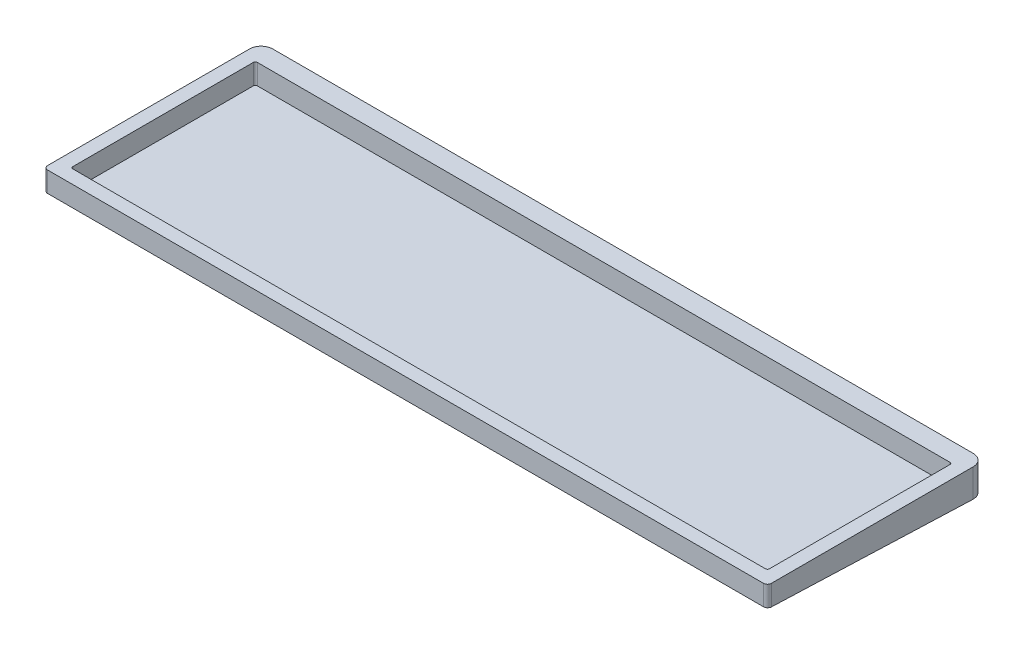
from build123d import *

# Parameters (mm, degrees)
BOSS_EXTRUDE1_DEPTH = 10.5
BOSS_EXTRUDE3_START = 10.5
BOSS_EXTRUDE3_DEPTH = 10.5
CUT_EXTRUDE1_DEPTH  = 400
CUT_EXTRUDE2_DEPTH  = 40
CUT_EXTRUDE3_DEPTH  = 40


with BuildPart() as part:
    # Sketch2 → Boss-Extrude1 (new body)
    with BuildSketch(Plane(origin=(0, 0, 0), x_dir=(1, 0, 0), z_dir=(0, 1, 0))):
        with BuildLine():
            Line((180.825, 57.625), (-180.825, 57.625))
            ThreePointArc((-180.825, 57.625), (-185.067640687, 55.867640687), (-186.825, 51.625))
            Line((-186.825, 51.625), (-186.825, -52.625))
            ThreePointArc((-186.825, -52.625), (-186.239213562, -54.039213562), (-184.825, -54.625))
            Line((-184.825, -54.625), (184.825, -54.625))
            ThreePointArc((184.825, -54.625), (186.239213562, -54.039213562), (186.825, -52.625))
            Line((186.825, -52.625), (186.825, 51.625))
            ThreePointArc((186.825, 51.625), (185.067640687, 55.867640687), (180.825, 57.625))
        make_face()
        with BuildLine():
            Line((-179.825, -46.625), (-179.825, 46.625))
            ThreePointArc((-179.825, 46.625), (-179.532106781, 47.332106781), (-178.825, 47.625))
            Line((-178.825, 47.625), (178.825, 47.625))
            ThreePointArc((178.825, 47.625), (179.532106781, 47.332106781), (179.825, 46.625))
            Line((179.825, 46.625), (179.825, -46.625))
            ThreePointArc((179.825, -46.625), (179.532106781, -47.332106781), (178.825, -47.625))
            Line((178.825, -47.625), (-178.825, -47.625))
            ThreePointArc((-178.825, -47.625), (-179.532106781, -47.332106781), (-179.825, -46.625))
        make_face(mode=Mode.SUBTRACT)
    extrude(amount=BOSS_EXTRUDE1_DEPTH)

    # Sketch4 → Boss-Extrude3 (add)
    with BuildSketch(Plane.XZ.offset(BOSS_EXTRUDE3_START)):
        with BuildLine():
            ThreePointArc((180.825, -57.625), (185.067640687, -55.867640687), (186.825, -51.625))
            Line((186.825, -51.625), (186.825, 52.625))
            ThreePointArc((186.825, 52.625), (186.239213562, 54.039213562), (184.825, 54.625))
            Line((184.825, 54.625), (-184.825, 54.625))
            ThreePointArc((-184.825, 54.625), (-186.239213562, 54.039213562), (-186.825, 52.625))
            Line((-186.825, 52.625), (-186.825, -51.625))
            ThreePointArc((-186.825, -51.625), (-185.067640687, -55.867640687), (-180.825, -57.625))
            Line((-180.825, -57.625), (180.825, -57.625))
        make_face()
    extrude(amount=-BOSS_EXTRUDE3_DEPTH)

    # Sketch5 → Cut-Extrude1 (cut)
    with BuildSketch(Plane(origin=(186.825, 0, 0), x_dir=(0, 0, -1), z_dir=(1, 0, 0))):
        Polygon((57.625, -10.5), (57.625, -4), (51.625, -4), (40.947921748, -10.5), align=None)
        Polygon((40.947921748, -10.5), (-54.625, 0), (-54.625, -10.5), align=None)
    extrude(amount=-CUT_EXTRUDE1_DEPTH, mode=Mode.SUBTRACT)

    # Sketch6 → Cut-Extrude2 (cut)
    with BuildSketch(Plane(origin=(186.825, 0, 0), x_dir=(0, 0, -1), z_dir=(1, 0, 0))):
        Polygon((-54.625, 0), (51.625, -4), (40.947921748, -10.5), align=None)
    extrude(amount=-CUT_EXTRUDE2_DEPTH, mode=Mode.SUBTRACT)

    # Sketch7 → Cut-Extrude3 (cut)
    with BuildSketch(Plane.ZY.offset(186.825)):
        Polygon((-51.625, -4), (-40.947921748, -10.5), (52.625, -0.219727509), align=None)
    extrude(amount=-CUT_EXTRUDE3_DEPTH, mode=Mode.SUBTRACT)


solid = part.part
